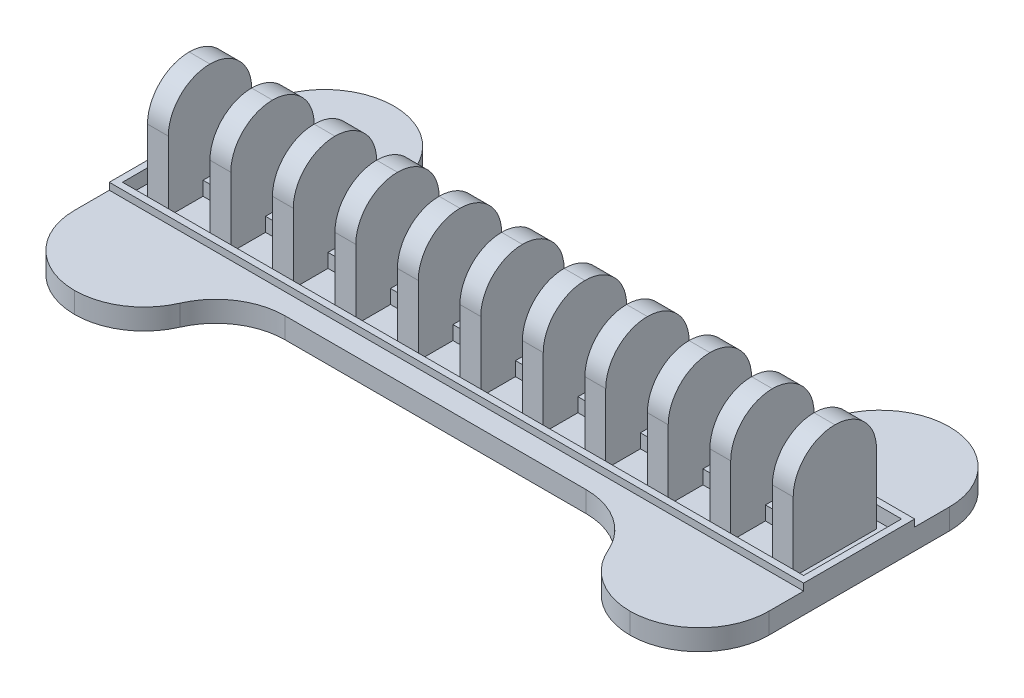
from build123d import *

# Parameters (mm, degrees)
SKETCH1_W            = 100
SKETCH1_H            = 16
BOSS_EXTRUDE1_DEPTH  = 3
SKETCH2_W            = 98
SKETCH2_H            = 14
CUT_EXTRUDE1_DEPTH   = 1
SKETCH5_W            = 20
SKETCH5_H            = 3
BOSS_EXTRUDE4_DEPTH  = 15
SKETCH6_W            = 20
SKETCH6_H            = 3
BOSS_EXTRUDE5_DEPTH  = 15
FILLET18_R           = 10
SKETCH7_W            = 3
SKETCH7_H            = 12
BOSS_EXTRUDE6_DEPTH  = 16
SKETCH8_W            = 6
SKETCH8_H            = 2
BOSS_EXTRUDE7_DEPTH  = 2
FILLET19_R           = 6
SKETCH10_W           = 60
SKETCH10_H           = 3
BOSS_EXTRUDE8_DEPTH  = 3
SKETCH11_W           = 60
SKETCH11_H           = 3
BOSS_EXTRUDE9_DEPTH  = 3
SKETCH12_W           = 0.95
SKETCH12_H           = 14
BOSS_EXTRUDE10_DEPTH = 3
SKETCH13_W           = 100
SKETCH13_H           = 0.95
BOSS_EXTRUDE11_DEPTH = 3
SKETCH14_W           = 0.95
SKETCH14_H           = 0.052088128
BOSS_EXTRUDE12_DEPTH = 3
SKETCH15_W           = 0.95
SKETCH15_H           = 0.047911872
SKETCH15_W_2         = 0.949734752
SKETCH15_H_2         = 0.052088128
BOSS_EXTRUDE13_DEPTH = 3
FILLET20_R           = 10
SKETCH17_W           = 98.1
SKETCH17_H           = 14.1
SKETCH17_W_2         = 97.1
SKETCH17_H_2         = 13.1
CUT_EXTRUDE2_DEPTH   = 4
SKETCH18_W           = 100
SKETCH18_H           = 16.05
SKETCH18_W_2         = 98
SKETCH18_H_2         = 14.05
CUT_EXTRUDE3_DEPTH   = 2


with BuildPart() as part:
    # Sketch1 → Boss-Extrude1 (new body)
    with BuildSketch(Plane(origin=(0, 0, 0), x_dir=(1, 0, 0), z_dir=(0, 1, 0))):
        with Locations((50, 8)):
            Rectangle(SKETCH1_W, SKETCH1_H)
    extrude(amount=BOSS_EXTRUDE1_DEPTH)

    # Sketch2 → Cut-Extrude1 (cut)
    with BuildSketch(Plane(origin=(0, 3, 0), x_dir=(1, 0, 0), z_dir=(0, 1, 0))):
        with Locations((50, 8)):
            Rectangle(SKETCH2_W, SKETCH2_H)
    extrude(amount=-CUT_EXTRUDE1_DEPTH, mode=Mode.SUBTRACT)

    # Sketch5 → Boss-Extrude4 (add)
    with BuildSketch(Plane.XY):
        with Locations((10, 1.5)):
            Rectangle(SKETCH5_W, SKETCH5_H)
        with Locations((90, 1.5)):
            Rectangle(SKETCH5_W, SKETCH5_H)
    extrude(amount=BOSS_EXTRUDE4_DEPTH)

    # Sketch6 → Boss-Extrude5 (add)
    with BuildSketch(Plane(origin=(0, 0, -16), x_dir=(-1, 0, 0), z_dir=(0, 0, -1))):
        with Locations((-90, 1.5)):
            Rectangle(SKETCH6_W, SKETCH6_H)
        with Locations((-10, 1.5)):
            Rectangle(SKETCH6_W, SKETCH6_H)
    extrude(amount=BOSS_EXTRUDE5_DEPTH)

    # Fillet18
    fillet18_edges = [part.edges().sort_by_distance(p)[0] for p in [
        (20, 1.5, 15),
        (0, 1.5, 15),
        (80, 1.5, 15),
        (100, 1.5, 15),
        (0, 1.5, -31),
        (20, 1.5, -31),
        (80, 1.5, -31),
        (100, 1.5, -31),
    ]]
    fillet(fillet18_edges, radius=FILLET18_R - 0.0001)  # a hair under: the kernel refuses the full size

    # Sketch7 → Boss-Extrude6 (add)
    with BuildSketch(Plane(origin=(0, 2, 0), x_dir=(1, 0, 0), z_dir=(0, 1, 0))):
        with Locations((95, 8)):
            Rectangle(SKETCH7_W, SKETCH7_H)
        with Locations((86, 8)):
            Rectangle(SKETCH7_W, SKETCH7_H)
        with Locations((77, 8)):
            Rectangle(SKETCH7_W, SKETCH7_H)
        with Locations((68, 8)):
            Rectangle(SKETCH7_W, SKETCH7_H)
        with Locations((59, 8)):
            Rectangle(SKETCH7_W, SKETCH7_H)
        with Locations((50, 8)):
            Rectangle(SKETCH7_W, SKETCH7_H)
        with Locations((41, 8)):
            Rectangle(SKETCH7_W, SKETCH7_H)
        with Locations((32, 8)):
            Rectangle(SKETCH7_W, SKETCH7_H)
        with Locations((23, 8)):
            Rectangle(SKETCH7_W, SKETCH7_H)
        with Locations((14, 8)):
            Rectangle(SKETCH7_W, SKETCH7_H)
        with Locations((5, 8)):
            Rectangle(SKETCH7_W, SKETCH7_H)
    extrude(amount=BOSS_EXTRUDE6_DEPTH)

    # Sketch8 → Boss-Extrude7 (add)
    with BuildSketch(Plane(origin=(0, 2, 0), x_dir=(1, 0, 0), z_dir=(0, 1, 0))):
        with Locations((90.5, 8)):
            Rectangle(SKETCH8_W, SKETCH8_H)
        with Locations((81.5, 8)):
            Rectangle(SKETCH8_W, SKETCH8_H)
        with Locations((72.5, 8)):
            Rectangle(SKETCH8_W, SKETCH8_H)
        with Locations((63.5, 8)):
            Rectangle(SKETCH8_W, SKETCH8_H)
        with Locations((54.5, 8)):
            Rectangle(SKETCH8_W, SKETCH8_H)
        with Locations((45.5, 8)):
            Rectangle(SKETCH8_W, SKETCH8_H)
        with Locations((36.5, 8)):
            Rectangle(SKETCH8_W, SKETCH8_H)
        with Locations((27.5, 8)):
            Rectangle(SKETCH8_W, SKETCH8_H)
        with Locations((18.5, 8)):
            Rectangle(SKETCH8_W, SKETCH8_H)
        with Locations((9.5, 8)):
            Rectangle(SKETCH8_W, SKETCH8_H)
    extrude(amount=BOSS_EXTRUDE7_DEPTH)

    # Fillet19
    fillet19_edges = [part.edges().sort_by_distance(p)[0] for p in [
        (95, 18, -2),
        (95, 18, -14),
        (86, 18, -2),
        (86, 18, -14),
        (77, 18, -2),
        (77, 18, -14),
        (68, 18, -2),
        (68, 18, -14),
        (59, 18, -2),
        (59, 18, -14),
        (50, 18, -2),
        (50, 18, -14),
        (41, 18, -2),
        (41, 18, -14),
        (32, 18, -2),
        (32, 18, -14),
        (23, 18, -14),
        (23, 18, -2),
        (14, 18, -2),
        (14, 18, -14),
        (5, 18, -2),
        (5, 18, -14),
    ]]
    fillet(fillet19_edges, radius=FILLET19_R - 0.0001)  # a hair under: the kernel refuses the full size

    # Sketch10 → Boss-Extrude8 (add)
    with BuildSketch(Plane(origin=(0, 0, -16), x_dir=(-1, 0, 0), z_dir=(0, 0, -1))):
        with Locations((-50, 1.5)):
            Rectangle(SKETCH10_W, SKETCH10_H)
    extrude(amount=BOSS_EXTRUDE8_DEPTH)

    # Sketch11 → Boss-Extrude9 (add)
    with BuildSketch(Plane.XY):
        with Locations((50, 1.5)):
            Rectangle(SKETCH11_W, SKETCH11_H)
    extrude(amount=BOSS_EXTRUDE9_DEPTH)

    # Sketch12 → Boss-Extrude10 (add)
    with BuildSketch(Plane(origin=(0, 3, 0), x_dir=(1, 0, 0), z_dir=(0, 1, 0))):
        with Locations((99.525, 7.997911872)):
            Rectangle(SKETCH12_W, SKETCH12_H)
        with Locations((0.475, 7.997911872)):
            Rectangle(SKETCH12_W, SKETCH12_H)
    extrude(amount=BOSS_EXTRUDE10_DEPTH)

    # Sketch13 → Boss-Extrude11 (add)
    with BuildSketch(Plane(origin=(0, 3, 0), x_dir=(1, 0, 0), z_dir=(0, 1, 0))):
        with Locations((50, 15.525)):
            Rectangle(SKETCH13_W, SKETCH13_H)
        with Locations((50, 0.475)):
            Rectangle(SKETCH13_W, SKETCH13_H)
    extrude(amount=BOSS_EXTRUDE11_DEPTH)

    # Sketch14 → Boss-Extrude12 (add)
    with BuildSketch(Plane(origin=(0, 3, 0), x_dir=(1, 0, 0), z_dir=(0, 1, 0))):
        with Locations((0.475, 15.023955936)):
            Rectangle(SKETCH14_W, SKETCH14_H)
    extrude(amount=BOSS_EXTRUDE12_DEPTH)

    # Sketch15 → Boss-Extrude13 (add)
    with BuildSketch(Plane(origin=(0, 3, 0), x_dir=(1, 0, 0), z_dir=(0, 1, 0))):
        with Locations((0.475, 0.973955936)):
            Rectangle(SKETCH15_W, SKETCH15_H)
        with Locations((99.525132624, 0.973955936)):
            Rectangle(SKETCH15_W_2, SKETCH15_H)
        with Locations((99.525, 15.023955936)):
            Rectangle(SKETCH15_W, SKETCH15_H_2)
    extrude(amount=BOSS_EXTRUDE13_DEPTH)

    # Fillet20
    fillet20_edges = [part.edges().sort_by_distance(p)[0] for p in [
        (20, 1.5, -19),
        (80, 1.5, -19),
        (80, 1.5, 3),
        (20, 1.5, 3),
    ]]
    fillet(fillet20_edges, radius=FILLET20_R)

    # Sketch17 → Cut-Extrude2 (cut)
    with BuildSketch(Plane(origin=(0, 6, 0), x_dir=(1, 0, 0), z_dir=(0, 1, 0))):
        with Locations((50, 8)):
            Rectangle(SKETCH17_W, SKETCH17_H)
        with Locations((50, 8)):
            Rectangle(SKETCH17_W_2, SKETCH17_H_2, mode=Mode.SUBTRACT)
    extrude(amount=-CUT_EXTRUDE2_DEPTH, mode=Mode.SUBTRACT)

    # Sketch18 → Cut-Extrude3 (cut)
    with BuildSketch(Plane(origin=(0, 6, 0), x_dir=(1, 0, 0), z_dir=(0, 1, 0))):
        with Locations((50, 7.975)):
            Rectangle(SKETCH18_W, SKETCH18_H)
        with Locations((50, 7.975)):
            Rectangle(SKETCH18_W_2, SKETCH18_H_2, mode=Mode.SUBTRACT)
    extrude(amount=-CUT_EXTRUDE3_DEPTH, mode=Mode.SUBTRACT)


solid = part.part
